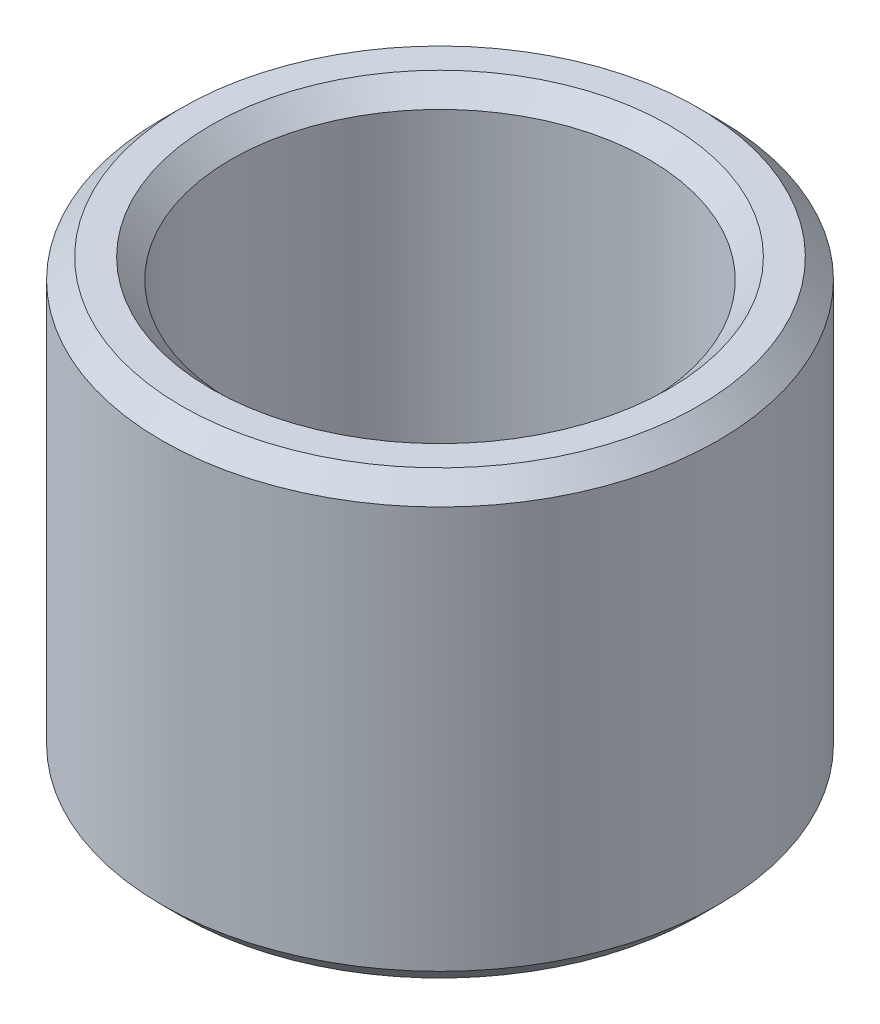
from build123d import *

# Parameters (mm, degrees)
SKETCH1_R           = 15
BOSS_EXTRUDE1_DEPTH = 23.822157441
SKETCH2_R           = 11.25794864
CUT_EXTRUDE1_DEPTH  = 32.898200343
CHAMFER1_SIZE       = 1.071347074


with BuildPart() as part:
    # Sketch1 → Boss-Extrude1 (new body)
    with BuildSketch(Plane(origin=(0, 0, 0), x_dir=(1, 0, 0), z_dir=(0, 1, 0))):
        Circle(SKETCH1_R)
    extrude(amount=BOSS_EXTRUDE1_DEPTH)

    # Sketch2 → Cut-Extrude1 (cut, through all)
    with BuildSketch(Plane(origin=(0, 0, 0), x_dir=(1, 0, 0), z_dir=(0, 1, 0))):
        Circle(SKETCH2_R)
    extrude(amount=CUT_EXTRUDE1_DEPTH, mode=Mode.SUBTRACT)

    # Chamfer1
    chamfer1_edges = [part.edges().sort_by_distance(p)[0] for p in [
        (-11.25794864, 23.822157441, 0),
        (-11.25794864, 0, 0),
        (-15, 0, 0),
        (-15, 23.822157441, 0),
    ]]
    chamfer(chamfer1_edges, length=CHAMFER1_SIZE)


solid = part.part
